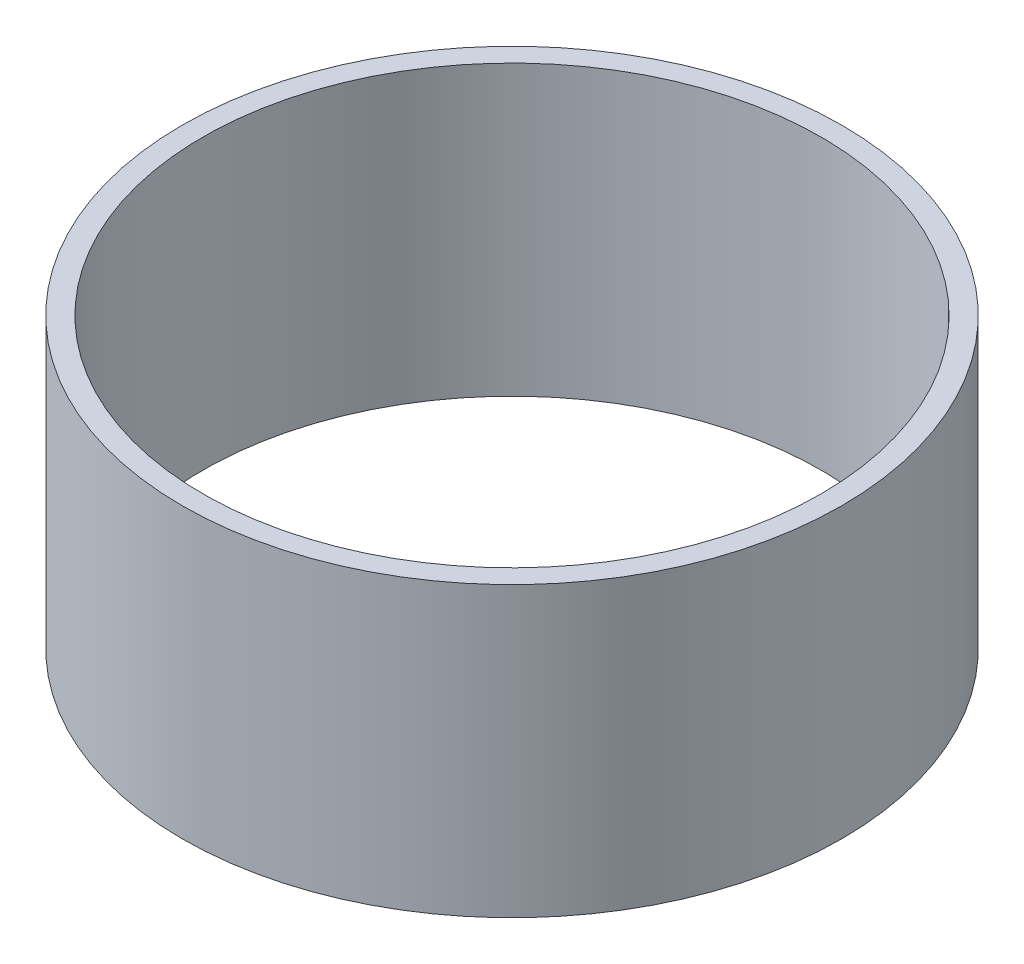
from build123d import *

# Parameters (mm, degrees)
SKETCH_1_R      = 80
SKETCH_1_R_2    = 75
EXTRUDE_1_DEPTH = 70


with BuildPart() as part:
    # Эскиз1 → Вытянуть-Тонкостенный1 (new body)
    with BuildSketch(Plane(origin=(0, 0, 0), x_dir=(1, 0, 0), z_dir=(0, 1, 0))):
        Circle(SKETCH_1_R)
        Circle(SKETCH_1_R_2, mode=Mode.SUBTRACT)
    extrude(amount=EXTRUDE_1_DEPTH)


solid = part.part
